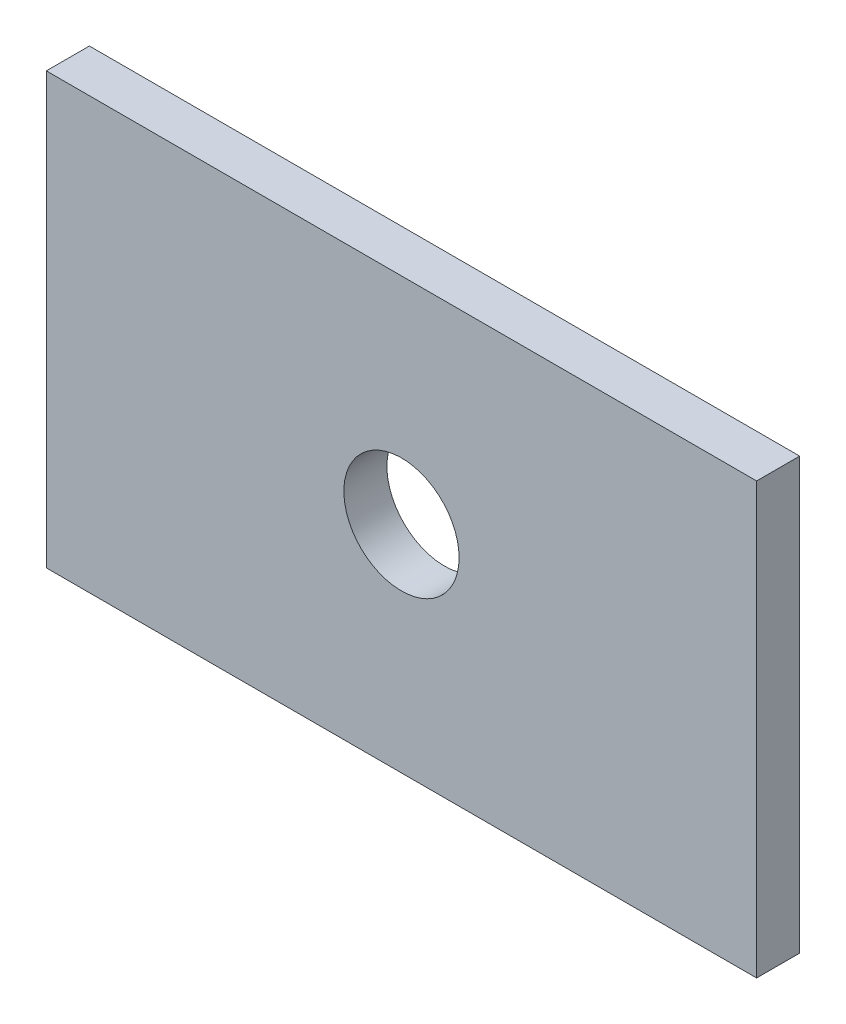
from build123d import *

# Parameters (mm, degrees)
SKETCH1_W           = 104.775
SKETCH1_H           = 63.5
BOSS_EXTRUDE1_DEPTH = 6.35
CUT_EXTRUDE1_REACH  = 63.586
SKETCH2_R           = 8.5


with BuildPart() as part:
    # Sketch1 → Boss-Extrude1 (new body)
    with BuildSketch(Plane.XY):
        Rectangle(SKETCH1_W, SKETCH1_H)
    extrude(amount=BOSS_EXTRUDE1_DEPTH)

    # Sketch2 → Cut-Extrude1 (cut, up to next)
    with BuildSketch(Plane.XY.offset(6.35), mode=Mode.PRIVATE) as cut_extrude1_sk1:
        Circle(SKETCH2_R)
    cut_extrude1_tool1 = extrude(cut_extrude1_sk1.sketch, amount=-CUT_EXTRUDE1_REACH, mode=Mode.PRIVATE) & part.part
    add(cut_extrude1_tool1.solids().sort_by_distance((0, 0, 6.35))[0], mode=Mode.SUBTRACT)


solid = part.part
